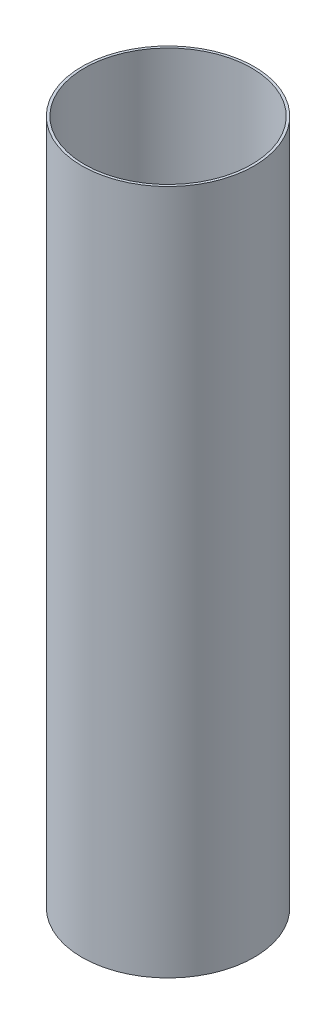
from build123d import *

# Parameters (mm, degrees)
SKETCH1_R           = 65.405
SKETCH1_R_2         = 63.5
BOSS_EXTRUDE1_DEPTH = 260.35


with BuildPart() as part:
    # Sketch1 → Boss-Extrude1 (new, symmetric)
    with BuildSketch(Plane(origin=(0, 0, 0), x_dir=(1, 0, 0), z_dir=(0, 1, 0))):
        Circle(SKETCH1_R)
        Circle(SKETCH1_R_2, mode=Mode.SUBTRACT)
    extrude(amount=BOSS_EXTRUDE1_DEPTH, both=True)


solid = part.part
